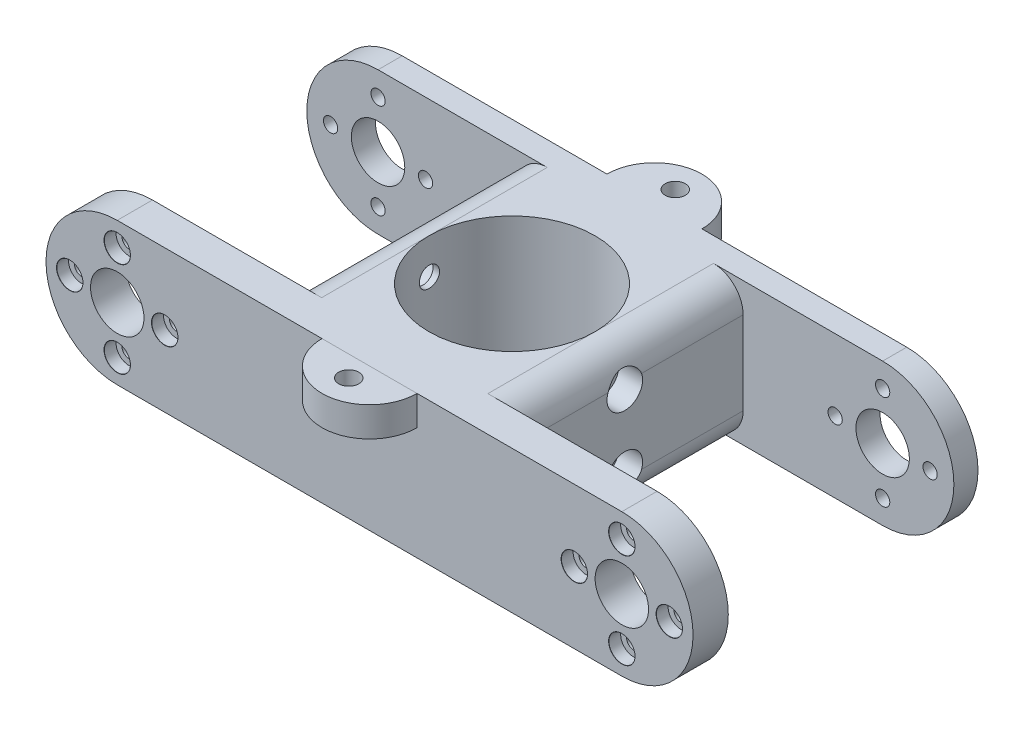
from build123d import *

# Parameters (mm, degrees)
BOSS_EXTRUDE1_DEPTH           = 48
CBORE_FOR_M2_SHCS1_AT_2_COUNT = 2
CBORE_FOR_M2_SHCS1_AT_2_PITCH = 11.313708499
CBORE_FOR_M2_SHCS1_AT_3_COUNT = 2
CBORE_FOR_M2_SHCS1_AT_3_PITCH = 16
CBORE_FOR_M2_SHCS1_AT_4_COUNT = 2
CBORE_FOR_M2_SHCS1_AT_4_PITCH = 11.313708499
CBORE_FOR_M2_SHCS1_AT_5_COUNT = 2
CBORE_FOR_M2_SHCS1_AT_5_PITCH = 77.414468932
CBORE_FOR_M2_SHCS1_AT_6_COUNT = 2
CBORE_FOR_M2_SHCS1_AT_6_PITCH = 93.343451832
CBORE_FOR_M2_SHCS1_AT_7_COUNT = 2
CBORE_FOR_M2_SHCS1_AT_7_PITCH = 85
CBORE_FOR_M2_SHCS1_AT_8_COUNT = 2
CBORE_FOR_M2_SHCS1_AT_8_PITCH = 86.492774265
SKETCH5_R                     = 14
SKETCH5_W                     = 35.5
SKETCH5_H                     = 38
CUT_EXTRUDE1_DEPTH            = 77.486926988
SKETCH6_R                     = 4.5
CUT_EXTRUDE2_DEPTH            = 74.608763065
CBORE_FOR_M2_SHCS2_AT_2_COUNT = 2
CBORE_FOR_M2_SHCS2_AT_2_PITCH = 11.313708499
CBORE_FOR_M2_SHCS2_AT_3_COUNT = 2
CBORE_FOR_M2_SHCS2_AT_3_PITCH = 11.313708499
CBORE_FOR_M2_SHCS2_AT_4_COUNT = 2
CBORE_FOR_M2_SHCS2_AT_4_PITCH = 16
CBORE_FOR_M2_SHCS2_AT_5_COUNT = 2
CBORE_FOR_M2_SHCS2_AT_5_PITCH = 85
CBORE_FOR_M2_SHCS2_AT_6_COUNT = 2
CBORE_FOR_M2_SHCS2_AT_6_PITCH = 93.343451832
CBORE_FOR_M2_SHCS2_AT_7_COUNT = 2
CBORE_FOR_M2_SHCS2_AT_7_PITCH = 86.492774265
CBORE_FOR_M2_SHCS2_AT_8_COUNT = 2
CBORE_FOR_M2_SHCS2_AT_8_PITCH = 77.414468932
FILLET1_R                     = 5
CBORE_FOR_M3_SHCS1_AT_2_COUNT = 2
CBORE_FOR_M3_SHCS1_AT_2_PITCH = 12
SKETCH12_R                    = 3
CUT_EXTRUDE3_DEPTH            = 4
BOSS_EXTRUDE2_DEPTH           = 5
SKETCH14_R                    = 1.7
CUT_EXTRUDE7_DEPTH            = 5


with BuildPart() as part:
    # Sketch1 → Boss-Extrude1 (new body)
    with BuildSketch(Plane.XY):
        with BuildLine():
            Line((-42.5, 12), (42.5, 12))
            ThreePointArc((42.5, 12), (54.5, 0), (42.5, -12))
            Line((42.5, -12), (-42.5, -12))
            ThreePointArc((-42.5, -12), (-54.5, 0), (-42.5, 12))
        make_face()
    extrude(amount=BOSS_EXTRUDE1_DEPTH)

    # Sketch4 → CBORE for M2 SHCS1 (revolve, cut)
    with BuildSketch(Plane(origin=(-42.5, 8, 48), x_dir=(0, -1, 0), z_dir=(1, 0, 0))):
        Polygon((0, 0), (0, 48), (1.2, 48), (1.2, 2), (2.2, 2), (2.2, 0.025), (2.225, 0), align=None)
    cbore_for_m2_shcs1 = revolve(axis=Axis((-42.5, 8, 54.35), (0, 0, -1)), mode=Mode.SUBTRACT)

    # CBORE for M2 SHCS1 at 2: CBORE for M2 SHCS1 ×2
    with Locations(*[Vector(0.7071067811865476, -0.7071067811865476, 0) * (i * CBORE_FOR_M2_SHCS1_AT_2_PITCH) for i in range(1, CBORE_FOR_M2_SHCS1_AT_2_COUNT)]):
        add(cbore_for_m2_shcs1, mode=Mode.SUBTRACT)

    # CBORE for M2 SHCS1 at 3: CBORE for M2 SHCS1 ×2
    with Locations(*[(0, -i * CBORE_FOR_M2_SHCS1_AT_3_PITCH, 0) for i in range(1, CBORE_FOR_M2_SHCS1_AT_3_COUNT)]):
        add(cbore_for_m2_shcs1, mode=Mode.SUBTRACT)

    # CBORE for M2 SHCS1 at 4: CBORE for M2 SHCS1 ×2
    with Locations(*[Vector(-0.7071067811865476, -0.7071067811865476, 0) * (i * CBORE_FOR_M2_SHCS1_AT_4_PITCH) for i in range(1, CBORE_FOR_M2_SHCS1_AT_4_COUNT)]):
        add(cbore_for_m2_shcs1, mode=Mode.SUBTRACT)

    # CBORE for M2 SHCS1 at 5: CBORE for M2 SHCS1 ×2
    with Locations(*[Vector(0.994646105081306, -0.10333985507338245, 0) * (i * CBORE_FOR_M2_SHCS1_AT_5_PITCH) for i in range(1, CBORE_FOR_M2_SHCS1_AT_5_COUNT)]):
        add(cbore_for_m2_shcs1, mode=Mode.SUBTRACT)

    # CBORE for M2 SHCS1 at 6: CBORE for M2 SHCS1 ×2
    with Locations(*[Vector(0.9963205578353481, -0.08570499422239554, 0) * (i * CBORE_FOR_M2_SHCS1_AT_6_PITCH) for i in range(1, CBORE_FOR_M2_SHCS1_AT_6_COUNT)]):
        add(cbore_for_m2_shcs1, mode=Mode.SUBTRACT)

    # CBORE for M2 SHCS1 at 7: CBORE for M2 SHCS1 ×2
    with Locations(*[(i * CBORE_FOR_M2_SHCS1_AT_7_PITCH, 0, 0) for i in range(1, CBORE_FOR_M2_SHCS1_AT_7_COUNT)]):
        add(cbore_for_m2_shcs1, mode=Mode.SUBTRACT)

    # CBORE for M2 SHCS1 at 8: CBORE for M2 SHCS1 ×2
    with Locations(*[Vector(0.9827410523322233, -0.184986551027242, 0) * (i * CBORE_FOR_M2_SHCS1_AT_8_PITCH) for i in range(1, CBORE_FOR_M2_SHCS1_AT_8_COUNT)]):
        add(cbore_for_m2_shcs1, mode=Mode.SUBTRACT)

    # Sketch5 → Cut-Extrude1 (cut, through all)
    with BuildSketch(Plane(origin=(0, 12, 0), x_dir=(1, 0, 0), z_dir=(0, 1, 0))):
        with Locations(Location((0, -24, 0), (0, 0, 270))):
            Circle(SKETCH5_R)
        with Locations((-36.75, -23.063087991)):
            Rectangle(SKETCH5_W, SKETCH5_H)
        with Locations((36.75, -23.063087991)):
            Rectangle(SKETCH5_W, SKETCH5_H)
    extrude(amount=-CUT_EXTRUDE1_DEPTH, mode=Mode.SUBTRACT)

    # Sketch6 → Cut-Extrude2 (cut, through all)
    with BuildSketch(Plane.XY.offset(48)):
        with Locations((-42.5, 0)):
            Circle(SKETCH6_R)
        with Locations((42.5, 0)):
            Circle(SKETCH6_R)
    extrude(amount=-CUT_EXTRUDE2_DEPTH, mode=Mode.SUBTRACT)

    # Sketch9 → CBORE for M2 SHCS2 (revolve, cut)
    with BuildSketch(Plane(origin=(42.5, 8, 0), x_dir=(0, 1, 0), z_dir=(1, 0, 0))):
        Polygon((0, 0), (0, 48), (1.2, 48), (1.2, 2), (2.2, 2), (2.2, 0.025), (2.225, 0), align=None)
    cbore_for_m2_shcs2 = revolve(axis=Axis((42.5, 8, -6.35), (0, 0, 1)), mode=Mode.SUBTRACT)

    # CBORE for M2 SHCS2 at 2: CBORE for M2 SHCS2 ×2
    with Locations(*[Vector(0.7071067811865476, -0.7071067811865476, 0) * (i * CBORE_FOR_M2_SHCS2_AT_2_PITCH) for i in range(1, CBORE_FOR_M2_SHCS2_AT_2_COUNT)]):
        add(cbore_for_m2_shcs2, mode=Mode.SUBTRACT)

    # CBORE for M2 SHCS2 at 3: CBORE for M2 SHCS2 ×2
    with Locations(*[Vector(-0.7071067811865476, -0.7071067811865476, 0) * (i * CBORE_FOR_M2_SHCS2_AT_3_PITCH) for i in range(1, CBORE_FOR_M2_SHCS2_AT_3_COUNT)]):
        add(cbore_for_m2_shcs2, mode=Mode.SUBTRACT)

    # CBORE for M2 SHCS2 at 4: CBORE for M2 SHCS2 ×2
    with Locations(*[(0, -i * CBORE_FOR_M2_SHCS2_AT_4_PITCH, 0) for i in range(1, CBORE_FOR_M2_SHCS2_AT_4_COUNT)]):
        add(cbore_for_m2_shcs2, mode=Mode.SUBTRACT)

    # CBORE for M2 SHCS2 at 5: CBORE for M2 SHCS2 ×2
    with Locations(*[(-i * CBORE_FOR_M2_SHCS2_AT_5_PITCH, 0, 0) for i in range(1, CBORE_FOR_M2_SHCS2_AT_5_COUNT)]):
        add(cbore_for_m2_shcs2, mode=Mode.SUBTRACT)

    # CBORE for M2 SHCS2 at 6: CBORE for M2 SHCS2 ×2
    with Locations(*[Vector(-0.9963205578353481, -0.08570499422239554, 0) * (i * CBORE_FOR_M2_SHCS2_AT_6_PITCH) for i in range(1, CBORE_FOR_M2_SHCS2_AT_6_COUNT)]):
        add(cbore_for_m2_shcs2, mode=Mode.SUBTRACT)

    # CBORE for M2 SHCS2 at 7: CBORE for M2 SHCS2 ×2
    with Locations(*[Vector(-0.9827410523322233, -0.184986551027242, 0) * (i * CBORE_FOR_M2_SHCS2_AT_7_PITCH) for i in range(1, CBORE_FOR_M2_SHCS2_AT_7_COUNT)]):
        add(cbore_for_m2_shcs2, mode=Mode.SUBTRACT)

    # CBORE for M2 SHCS2 at 8: CBORE for M2 SHCS2 ×2
    with Locations(*[Vector(-0.994646105081306, -0.10333985507338245, 0) * (i * CBORE_FOR_M2_SHCS2_AT_8_PITCH) for i in range(1, CBORE_FOR_M2_SHCS2_AT_8_COUNT)]):
        add(cbore_for_m2_shcs2, mode=Mode.SUBTRACT)

    # Fillet1
    fillet1_edges = [part.edges().sort_by_distance(p)[0] for p in [
        (19, -12, 23.063087991),
        (19, 12, 23.063087991),
        (-19, -12, 23.063087991),
        (-19, 12, 23.063087991),
    ]]
    fillet(fillet1_edges, radius=FILLET1_R - 0.0001)  # a hair under: the kernel refuses the full size

    # Sketch11 → CBORE for M3 SHCS1 (revolve, cut)
    with BuildSketch(Plane(origin=(-19, 6, 24), x_dir=(0, 0, 1), z_dir=(0, 1, 0))):
        Polygon((0, 0), (0, 73.5), (1.7, 73.5), (1.7, 4), (3.25, 4), (3.25, 0.025), (3.275, 0), align=None)
    cbore_for_m3_shcs1 = revolve(axis=Axis((-25.35, 6, 24), (1, 0, 0)), mode=Mode.SUBTRACT)

    # CBORE for M3 SHCS1 at 2: CBORE for M3 SHCS1 ×2
    with Locations(*[(0, -i * CBORE_FOR_M3_SHCS1_AT_2_PITCH, 0) for i in range(1, CBORE_FOR_M3_SHCS1_AT_2_COUNT)]):
        add(cbore_for_m3_shcs1, mode=Mode.SUBTRACT)

    # Sketch12 → Cut-Extrude3 (cut)
    with BuildSketch(Plane(origin=(19, 0, 0), x_dir=(0, 0, -1), z_dir=(1, 0, 0))):
        with Locations((-24, 6)):
            Circle(SKETCH12_R)
        with Locations((-24, -6)):
            Circle(SKETCH12_R)
    extrude(amount=-CUT_EXTRUDE3_DEPTH, mode=Mode.SUBTRACT)


with BuildPart() as body_2:
    # Sketch13 → Boss-Extrude2 (new body)
    with BuildSketch(Plane(origin=(0, 12, 0), x_dir=(1, 0, 0), z_dir=(0, 1, 0))):
        with BuildLine():
            Line((-8, -48), (8, -48))
            ThreePointArc((8, -48), (0, -56), (-8, -48))
        make_face()
    boss_extrude2 = extrude(amount=-BOSS_EXTRUDE2_DEPTH)

    # Sketch14 → Cut-Extrude7 (cut)
    with BuildSketch(Plane(origin=(0, 12, 0), x_dir=(1, 0, 0), z_dir=(0, 1, 0))):
        with Locations(Location((0, -51.5, 0), (0, 0, 270))):
            Circle(SKETCH14_R)
    cut_extrude7 = extrude(amount=-CUT_EXTRUDE7_DEPTH, mode=Mode.SUBTRACT)


with BuildPart() as part_1:
    add(part.part)

    # Mirror6: Boss-Extrude2, Cut-Extrude7 across plane
    add(boss_extrude2.mirror(Plane.XY.offset(24)))
    add(cut_extrude7.mirror(Plane.XY.offset(24)), mode=Mode.SUBTRACT)


solid = Compound([body_2.part, part_1.part])
